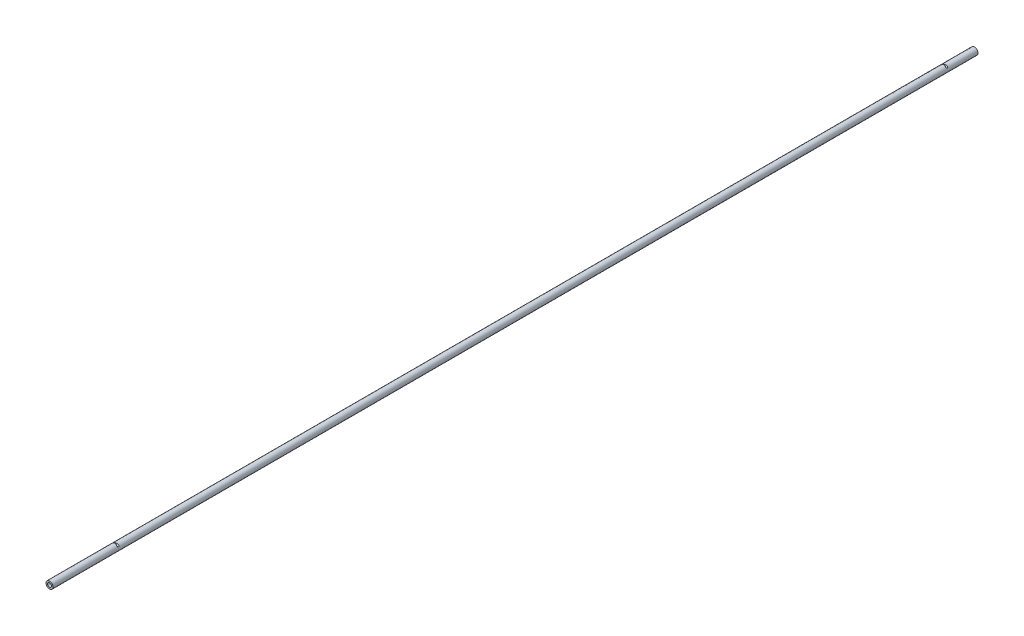
from build123d import *

# Parameters (mm, degrees)
SKETCH1_R           = 1.98
SKETCH1_R_2         = 1.125
EXTRUDE1_DEPTH      = 520
EXTRUDE2_DEPTH      = 521.007539176
EXTRUDE2_DEPTH_BACK = 521.007539176
SKETCH2_R           = 0.5


with BuildPart() as part:
    # Sketch1 → Extrude1 (new body)
    with BuildSketch(Plane.XY):
        Circle(SKETCH1_R)
        Circle(SKETCH1_R_2, mode=Mode.SUBTRACT)
    extrude(amount=EXTRUDE1_DEPTH)

    # Sketch2 → Extrude2 (cut, two sides: drawn at the far end of the back side and taken through both)
    with BuildSketch(Plane(origin=(0, 0, 0), x_dir=(0, 0, -1), z_dir=(1, 0, 0)).offset(-EXTRUDE2_DEPTH_BACK)):
        with Locations((-483, 1.5)):
            Circle(SKETCH2_R)
        with Locations((-17, 1.5)):
            Circle(SKETCH2_R)
    extrude(amount=EXTRUDE2_DEPTH + EXTRUDE2_DEPTH_BACK, mode=Mode.SUBTRACT)


solid = part.part
